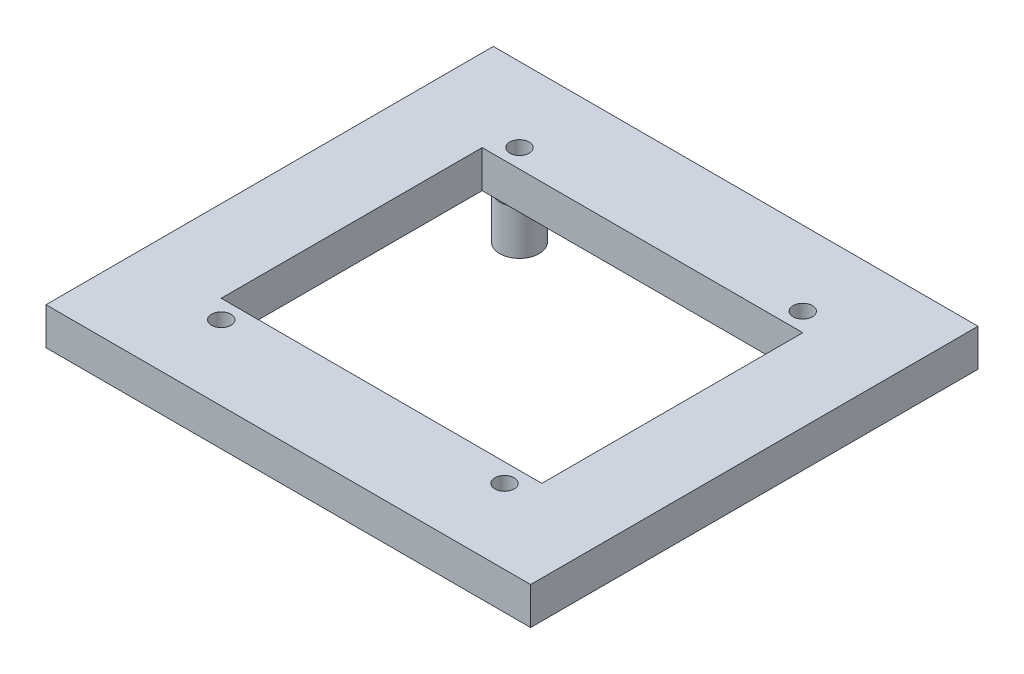
from build123d import *

# Parameters (mm, degrees)
SKETCH3_W           = 65
SKETCH3_H           = 60
BOSS_EXTRUDE3_DEPTH = 5
SKETCH5_W           = 43
SKETCH5_H           = 35
CUT_EXTRUDE2_DEPTH  = 10
CUT_EXTRUDE1_REACH  = 57.982
SKETCH4_R           = 1.3
SKETCH9_R           = 2.65
SKETCH9_R_2         = 1.05
BOSS_EXTRUDE5_DEPTH = 6


with BuildPart() as part:
    # Sketch3 → Boss-Extrude3 (new body)
    with BuildSketch(Plane(origin=(0, 0, 0), x_dir=(1, 0, 0), z_dir=(0, 1, 0))):
        with Locations((-14.5, 0)):
            Rectangle(SKETCH3_W, SKETCH3_H)
    extrude(amount=BOSS_EXTRUDE3_DEPTH)

    # Sketch5 → Cut-Extrude2 (cut)
    with BuildSketch(Plane.XZ):
        with Locations((-14.5, 0)):
            Rectangle(SKETCH5_W, SKETCH5_H)
    extrude(amount=-CUT_EXTRUDE2_DEPTH, mode=Mode.SUBTRACT)

    # Sketch4 → Cut-Extrude1 (cut, up to next)
    with BuildSketch(Plane(origin=(0, 5, 0), x_dir=(1, 0, 0), z_dir=(0, 1, 0)), mode=Mode.PRIVATE) as cut_extrude1_sk1:
        with Locations((-33.5, 20)):
            Circle(SKETCH4_R)
    cut_extrude1_tool1 = extrude(cut_extrude1_sk1.sketch, amount=-CUT_EXTRUDE1_REACH, mode=Mode.PRIVATE) & part.part
    # Sketch4 → Cut-Extrude1 (cut, up to next)
    with BuildSketch(Plane(origin=(0, 5, 0), x_dir=(1, 0, 0), z_dir=(0, 1, 0)), mode=Mode.PRIVATE) as cut_extrude1_sk2:
        with Locations((4.5, 20)):
            Circle(SKETCH4_R)
    cut_extrude1_tool2 = extrude(cut_extrude1_sk2.sketch, amount=-CUT_EXTRUDE1_REACH, mode=Mode.PRIVATE) & part.part
    # Sketch4 → Cut-Extrude1 (cut, up to next)
    with BuildSketch(Plane(origin=(0, 5, 0), x_dir=(1, 0, 0), z_dir=(0, 1, 0)), mode=Mode.PRIVATE) as cut_extrude1_sk3:
        with Locations((4.5, -20)):
            Circle(SKETCH4_R)
    cut_extrude1_tool3 = extrude(cut_extrude1_sk3.sketch, amount=-CUT_EXTRUDE1_REACH, mode=Mode.PRIVATE) & part.part
    # Sketch4 → Cut-Extrude1 (cut, up to next)
    with BuildSketch(Plane(origin=(0, 5, 0), x_dir=(1, 0, 0), z_dir=(0, 1, 0)), mode=Mode.PRIVATE) as cut_extrude1_sk4:
        with Locations((-33.5, -20)):
            Circle(SKETCH4_R)
    cut_extrude1_tool4 = extrude(cut_extrude1_sk4.sketch, amount=-CUT_EXTRUDE1_REACH, mode=Mode.PRIVATE) & part.part
    add(cut_extrude1_tool1.solids().sort_by_distance((-33.5, 5, -20))[0], mode=Mode.SUBTRACT)
    add(cut_extrude1_tool2.solids().sort_by_distance((4.5, 5, -20))[0], mode=Mode.SUBTRACT)
    add(cut_extrude1_tool3.solids().sort_by_distance((4.5, 5, 20))[0], mode=Mode.SUBTRACT)
    add(cut_extrude1_tool4.solids().sort_by_distance((-33.5, 5, 20))[0], mode=Mode.SUBTRACT)

    # Sketch9 → Boss-Extrude5 (add)
    # profile 1 of 4: a face of its own
    with BuildSketch(Plane.XZ):
        with Locations((-33.5, 20)):
            Circle(SKETCH9_R)
        with Locations((-33.5, 20)):
            Circle(SKETCH9_R_2, mode=Mode.SUBTRACT)
    # profile 2 of 4: a face of its own
    with BuildSketch(Plane.XZ):
        with Locations((-33.5, -20)):
            Circle(SKETCH9_R)
        with Locations((-33.5, -20)):
            Circle(SKETCH9_R_2, mode=Mode.SUBTRACT)
    # profile 3 of 4: a face of its own
    with BuildSketch(Plane.XZ):
        with Locations((4.5, 20)):
            Circle(SKETCH9_R)
        with Locations((4.5, 20)):
            Circle(SKETCH9_R_2, mode=Mode.SUBTRACT)
    # profile 4 of 4: a face of its own
    with BuildSketch(Plane.XZ):
        with Locations((4.5, -20)):
            Circle(SKETCH9_R)
        with Locations((4.5, -20)):
            Circle(SKETCH9_R_2, mode=Mode.SUBTRACT)
    extrude(amount=BOSS_EXTRUDE5_DEPTH)


solid = part.part
